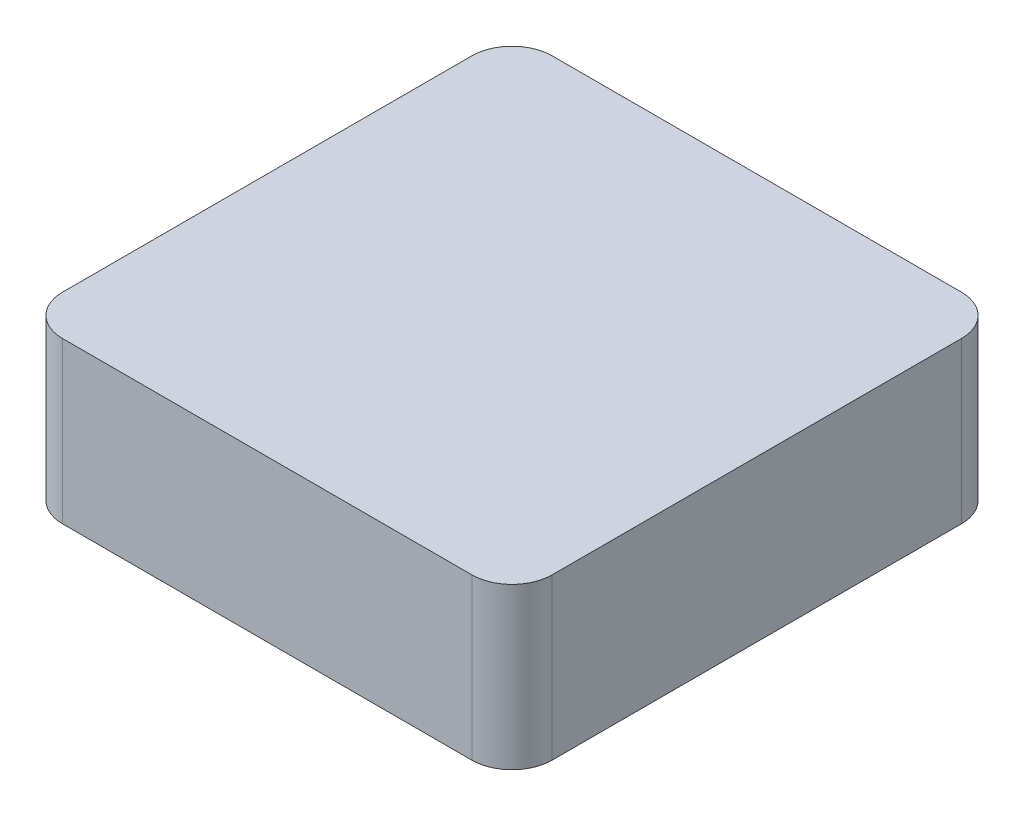
from build123d import *

# Parameters (mm, degrees)
CROQUIS1_W              = 61
CROQUIS1_H              = 61
SALIENTE_EXTRUIR1_DEPTH = 20
REDONDEO1_R             = 5


with BuildPart() as part:
    # Croquis1 → Saliente-Extruir1 (new body)
    with BuildSketch(Plane(origin=(0, 0, 0), x_dir=(1, 0, 0), z_dir=(0, 1, 0))):
        Rectangle(CROQUIS1_W, CROQUIS1_H)
    extrude(amount=SALIENTE_EXTRUIR1_DEPTH)

    # Redondeo1
    redondeo1_edges = [part.edges().sort_by_distance(p)[0] for p in [
        (-30.5, 10, -30.5),
        (30.5, 10, -30.5),
        (-30.5, 10, 30.5),
        (30.5, 10, 30.5),
    ]]
    fillet(redondeo1_edges, radius=REDONDEO1_R)


solid = part.part
